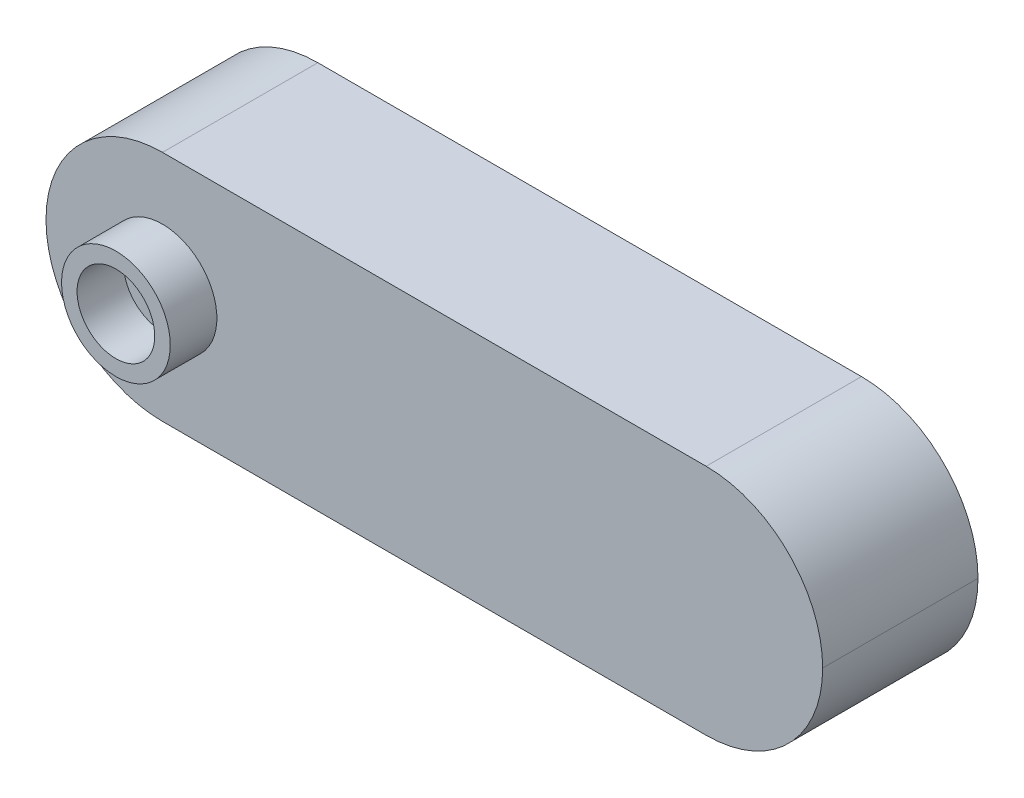
from build123d import *

# Parameters (mm, degrees)
SKETCH1_W           = 50
SKETCH1_H           = 15
BOSS_EXTRUDE1_DEPTH = 10
FILLET1_R           = 7.5
SKETCH2_R           = 3.5
SKETCH2_R_2         = 2.5
BOSS_EXTRUDE2_DEPTH = 3


with BuildPart() as part:
    # Sketch1 → Boss-Extrude1 (new body)
    with BuildSketch(Plane.XY):
        with Locations((25, 7.5)):
            Rectangle(SKETCH1_W, SKETCH1_H)
    extrude(amount=BOSS_EXTRUDE1_DEPTH)

    # Fillet1
    fillet1_edges = [part.edges().sort_by_distance(p)[0] for p in [
        (50, 0, 5),
        (50, 15, 5),
        (0, 0, 5),
        (0, 15, 5),
    ]]
    fillet(fillet1_edges, radius=FILLET1_R - 0.0001)  # a hair under: the kernel refuses the full size

    # Sketch2 → Boss-Extrude2 (add)
    with BuildSketch(Plane.XY.offset(10)):
        with Locations(Location((7.5, 7.5, 0), (0, 0, 180))):
            Circle(SKETCH2_R)
        with Locations((7.5, 7.5)):
            Circle(SKETCH2_R_2, mode=Mode.SUBTRACT)
    extrude(amount=BOSS_EXTRUDE2_DEPTH)


solid = part.part
